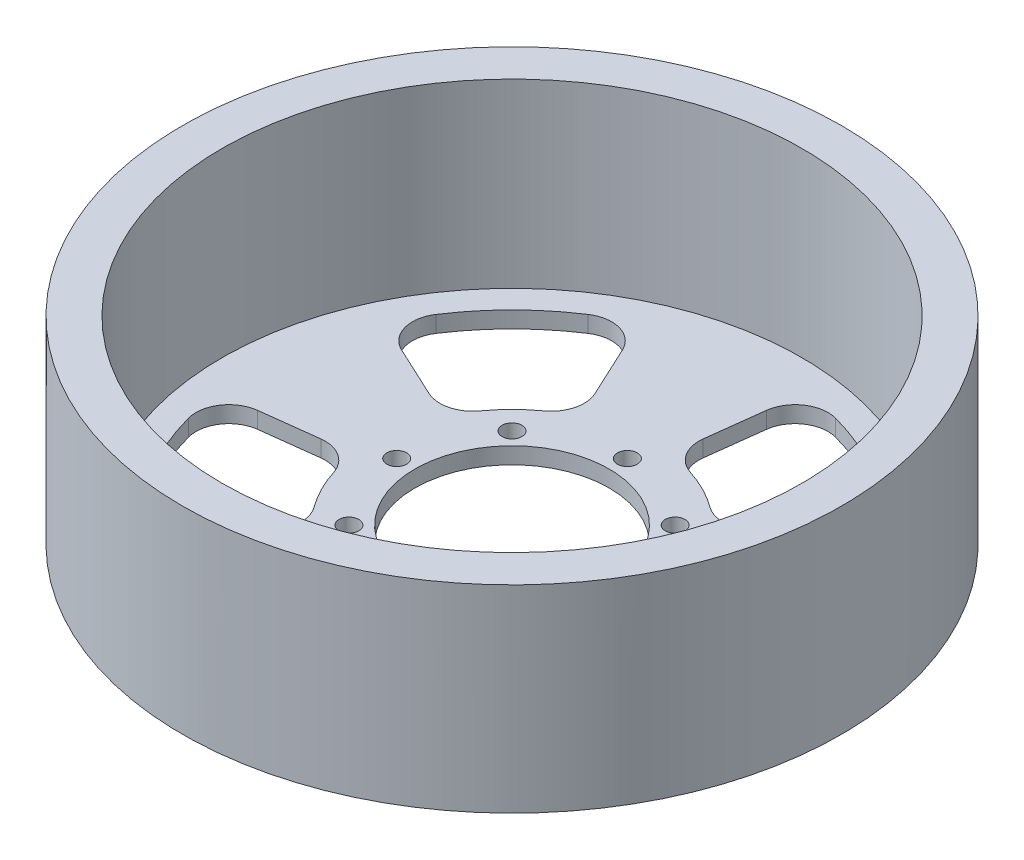
from build123d import *

# Parameters (mm, degrees)
SKETCH_1_R                       = 50
EXTRUDE_1_DEPTH                  = 50
SKETCH_2_R                       = 44
CUT_EXTRUDE_1_DEPTH              = 37.5
CUT_EXTRUDE_START                = -9.5
SKETCH_3_R                       = 44
CUT_EXTRUDE_2_DEPTH              = 9.5
SKETCH_4_R                       = 14.75
SKETCH_4_R_2                     = 1.5
CUT_EXTRUDE_3_DEPTH              = 4
CUT_EXTRUDE_4_DEPTH              = 4
FILLET_1_R                       = 5
PATTERN_CIRCULAR_1_COUNT         = 5
FILLET_1_OF_PATTERN_CIRCULAR_1_R = 5
SKETCH_11_R                      = 59.165085767
CUT_EXTRUDE_8_DEPTH              = 10
SKETCH_15_R                      = 58.048743464
CUT_EXTRUDE_10_DEPTH             = 10


with BuildPart() as part:
    # 草图1 → 凸台-拉伸1 (new body)
    with BuildSketch(Plane(origin=(0, 0, 0), x_dir=(1, 0, 0), z_dir=(0, 1, 0))):
        Circle(SKETCH_1_R)
    extrude(amount=EXTRUDE_1_DEPTH)

    # 草图2 → 切除-拉伸1 (cut)
    with BuildSketch(Plane(origin=(0, 50, 0), x_dir=(1, 0, 0), z_dir=(0, 1, 0))):
        Circle(SKETCH_2_R)
    extrude(amount=-CUT_EXTRUDE_1_DEPTH, mode=Mode.SUBTRACT)

    # 草图3 → 切除-拉伸2 (cut)
    with BuildSketch(Plane.XZ.offset(CUT_EXTRUDE_START)):
        Circle(SKETCH_3_R)
    extrude(amount=CUT_EXTRUDE_2_DEPTH, mode=Mode.SUBTRACT)

    # 草图4 → 切除-拉伸3 (cut)
    with BuildSketch(Plane(origin=(0, 12.5, 0), x_dir=(1, 0, 0), z_dir=(0, 1, 0))):
        Circle(SKETCH_4_R)
        with Locations((0, 17.5)):
            Circle(SKETCH_4_R_2)
        with Locations((12.374368671, 12.374368671)):
            Circle(SKETCH_4_R_2)
        with Locations((17.5, 0)):
            Circle(SKETCH_4_R_2)
        with Locations((12.374368671, -12.374368671)):
            Circle(SKETCH_4_R_2)
        with Locations((0, -17.5)):
            Circle(SKETCH_4_R_2)
        with Locations((-12.374368671, -12.374368671)):
            Circle(SKETCH_4_R_2)
        with Locations((-17.5, 0)):
            Circle(SKETCH_4_R_2)
        with Locations((-12.374368671, 12.374368671)):
            Circle(SKETCH_4_R_2)
    extrude(amount=-CUT_EXTRUDE_3_DEPTH, mode=Mode.SUBTRACT)

    # 草图8 → 切除-拉伸4 (cut)
    with BuildSketch(Plane(origin=(0, 12.5, 0), x_dir=(1, 0, 0), z_dir=(0, 1, 0))):
        with BuildLine():
            Line((4.874773736, 39.701846066), (2.620190883, 21.33974226))
            ThreePointArc((2.620190883, 21.33974226), (9.760795744, 19.15664027), (15.724104585, 14.662964741))
            Line((15.724104585, 14.662964741), (29.254148065, 27.279934402))
            ThreePointArc((29.254148065, 27.279934402), (18.15961999, 35.640260968), (4.874773736, 39.701846066))
        make_face()
    cut_extrude_4 = extrude(amount=-CUT_EXTRUDE_4_DEPTH, mode=Mode.SUBTRACT)

    # 圆角1
    fillet_1_edges = [part.edges().sort_by_distance(p)[0] for p in [
        (29.254148065, 11, -27.279934402),
        (15.724104585, 11, -14.662964741),
        (2.620190883, 11, -21.33974226),
        (4.874773736, 11, -39.701846066),
    ]]
    fillet(fillet_1_edges, radius=FILLET_1_R)

    # 阵列(圆周)1: 切除-拉伸4 ×5 about axis
    pattern_circular_1_axis = Axis((0, 50, 0), (0, 1, 0))
    for i in range(1, PATTERN_CIRCULAR_1_COUNT):
        add(cut_extrude_4.rotate(pattern_circular_1_axis, i * 360 / PATTERN_CIRCULAR_1_COUNT), mode=Mode.SUBTRACT)

    # 圆角1 of 阵列(圆周)1
    fillet_1_of_pattern_circular_1_edges = [part.edges().sort_by_distance(p)[0] for p in [
        (-16.90473047, 11, -36.252311481),
        (-9.086292627, 11, -19.485617421),
        (-19.485617421, 11, -9.086292627),
        (-36.252311481, 11, -16.90473047),
        (-39.701846066, 11, 4.874773736),
        (-21.33974226, 11, 2.620190883),
        (-14.662964741, 11, 15.724104585),
        (-27.279934402, 11, 29.254148065),
        (-7.632359815, 11, 39.265087338),
        (-4.102393401, 11, 21.104984444),
        (10.423406835, 11, 18.804323703),
        (19.39238481, 11, 34.984788286),
        (34.984788286, 11, 19.39238481),
        (18.804323703, 11, 10.423406835),
        (21.104984444, 11, -4.102393401),
        (39.265087338, 11, -7.632359815),
    ]]
    fillet(fillet_1_of_pattern_circular_1_edges, radius=FILLET_1_OF_PATTERN_CIRCULAR_1_R)

    # 草图11 → 切除-拉伸8 (cut)
    with BuildSketch(Plane.XZ):
        Circle(SKETCH_11_R)
    extrude(amount=-CUT_EXTRUDE_8_DEPTH, mode=Mode.SUBTRACT)

    # 草图15 → 切除-拉伸10 (cut)
    with BuildSketch(Plane(origin=(0, 50, 0), x_dir=(1, 0, 0), z_dir=(0, 1, 0))):
        Circle(SKETCH_15_R)
    extrude(amount=-CUT_EXTRUDE_10_DEPTH, mode=Mode.SUBTRACT)


solid = part.part
